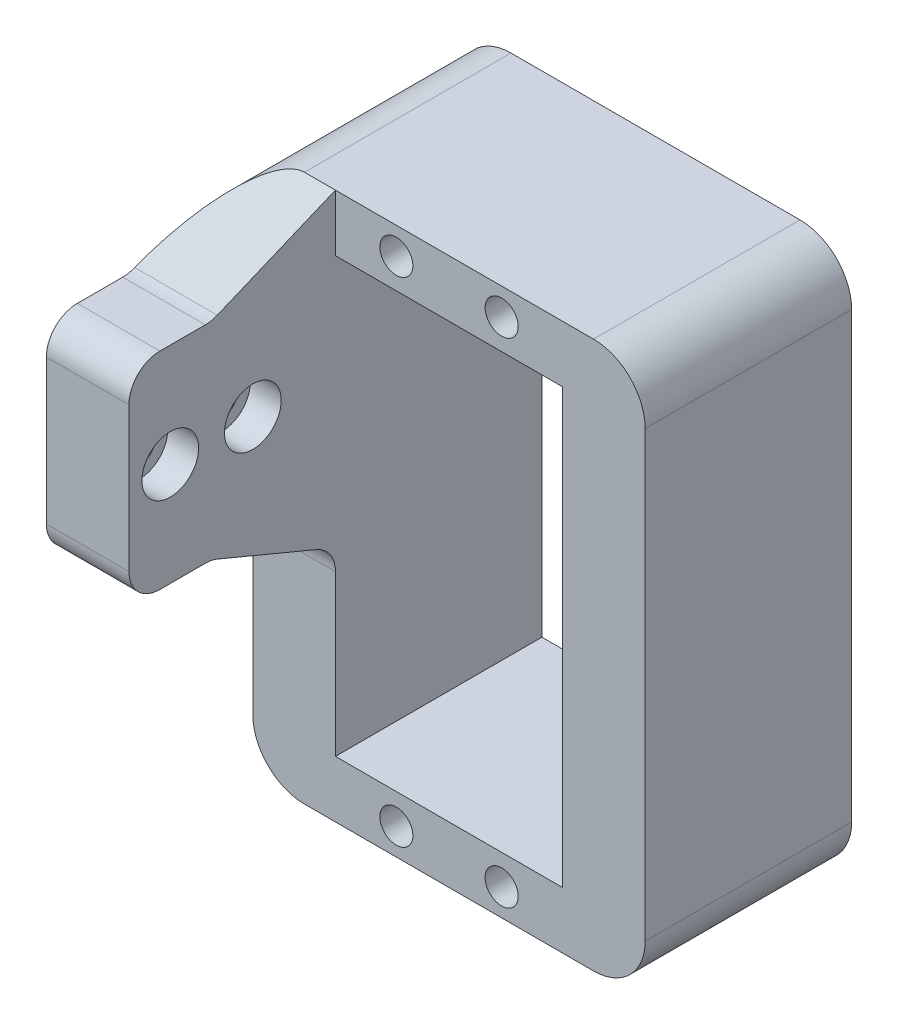
from build123d import *

# Parameters (mm, degrees)
SKETCH1_W           = 38
SKETCH1_H           = 53
SKETCH1_W_2         = 22
SKETCH1_H_2         = 42
BOSS_EXTRUDE1_DEPTH = 20
SKETCH2_W           = 8
SKETCH2_H           = 20
BOSS_EXTRUDE2_DEPTH = 20
SKETCH3_R           = 2.75
SKETCH3_R_2         = 1.6
CUT_EXTRUDE1_DEPTH  = 3
SKETCH3_2_R         = 1.6
CUT_EXTRUDE2_DEPTH  = 57.588426379
SKETCH4_R           = 1.6
CUT_EXTRUDE3_DEPTH  = 52.606685613
BOSS_EXTRUDE3_DEPTH = 8
FILLET2_R           = 3
FILLET1_R           = 5


with BuildPart() as part:
    # Sketch1 → Boss-Extrude1 (new body)
    with BuildSketch(Plane.XY):
        Rectangle(SKETCH1_W, SKETCH1_H)
        Rectangle(SKETCH1_W_2, SKETCH1_H_2, mode=Mode.SUBTRACT)
    extrude(amount=BOSS_EXTRUDE1_DEPTH)

    # Sketch2 → Boss-Extrude2 (add)
    with BuildSketch(Plane.XY.offset(20)):
        with Locations((-15, 11.5)):
            Rectangle(SKETCH2_W, SKETCH2_H)
    extrude(amount=BOSS_EXTRUDE2_DEPTH)

    # Sketch3 → Cut-Extrude1 (cut)
    # profile 1 of 2: a face of its own
    with BuildSketch(Plane(origin=(-11, 0, 0), x_dir=(0, 0, -1), z_dir=(1, 0, 0))):
        with Locations((-36, 11.5)):
            Circle(SKETCH3_R)
        with Locations((-36, 11.5)):
            Circle(SKETCH3_R_2, mode=Mode.SUBTRACT)
    # profile 2 of 2: a face of its own
    with BuildSketch(Plane(origin=(-11, 0, 0), x_dir=(0, 0, -1), z_dir=(1, 0, 0))):
        with Locations((-28, 11.5)):
            Circle(SKETCH3_R)
        with Locations((-28, 11.5)):
            Circle(SKETCH3_R_2, mode=Mode.SUBTRACT)
    extrude(amount=-CUT_EXTRUDE1_DEPTH, mode=Mode.SUBTRACT)

    # Sketch3<2> → Cut-Extrude2 (cut, through all)
    with BuildSketch(Plane(origin=(-11, 0, 0), x_dir=(0, 0, -1), z_dir=(1, 0, 0))):
        with Locations((-36, 11.5)):
            Circle(SKETCH3_2_R)
        with Locations((-28, 11.5)):
            Circle(SKETCH3_2_R)
    extrude(amount=-CUT_EXTRUDE2_DEPTH, mode=Mode.SUBTRACT)

    # Sketch4 → Cut-Extrude3 (cut, through all)
    with BuildSketch(Plane(origin=(0, 0, 0), x_dir=(-1, 0, 0), z_dir=(0, 0, -1))):
        with Locations((-5.1, -23.9)):
            Circle(SKETCH4_R)
        with Locations((5.1, -23.9)):
            Circle(SKETCH4_R)
        with Locations((-5.1, 23.9)):
            Circle(SKETCH4_R)
        with Locations((5.1, 23.9)):
            Circle(SKETCH4_R)
    extrude(amount=-CUT_EXTRUDE3_DEPTH, mode=Mode.SUBTRACT)

    # Sketch5 → Boss-Extrude3 (add)
    with BuildSketch(Plane.ZY.offset(19)):
        Polygon((32, 1.5), (20, -3.5), (20, 1.5), align=None)
        Polygon((20, 26.5), (20, 21.5), (32, 21.5), align=None)
    extrude(amount=-BOSS_EXTRUDE3_DEPTH)

    # Fillet2
    fillet2_edges = [part.edges().sort_by_distance(p)[0] for p in [
        (-15, 21.5, 32),
        (-15, 1.5, 40),
        (-15, 21.5, 40),
        (-15, -3.5, 20),
        (-15, 1.5, 32),
    ]]
    fillet(fillet2_edges, radius=FILLET2_R)

    # Fillet1
    fillet1_edges = [part.edges().sort_by_distance(p)[0] for p in [
        (-19, -26.5, 10),
        (19, -26.5, 10),
        (-19, 26.5, 10),
        (19, 26.5, 10),
    ]]
    fillet(fillet1_edges, radius=FILLET1_R - 0.0001)  # a hair under: the kernel refuses the full size


solid = part.part
